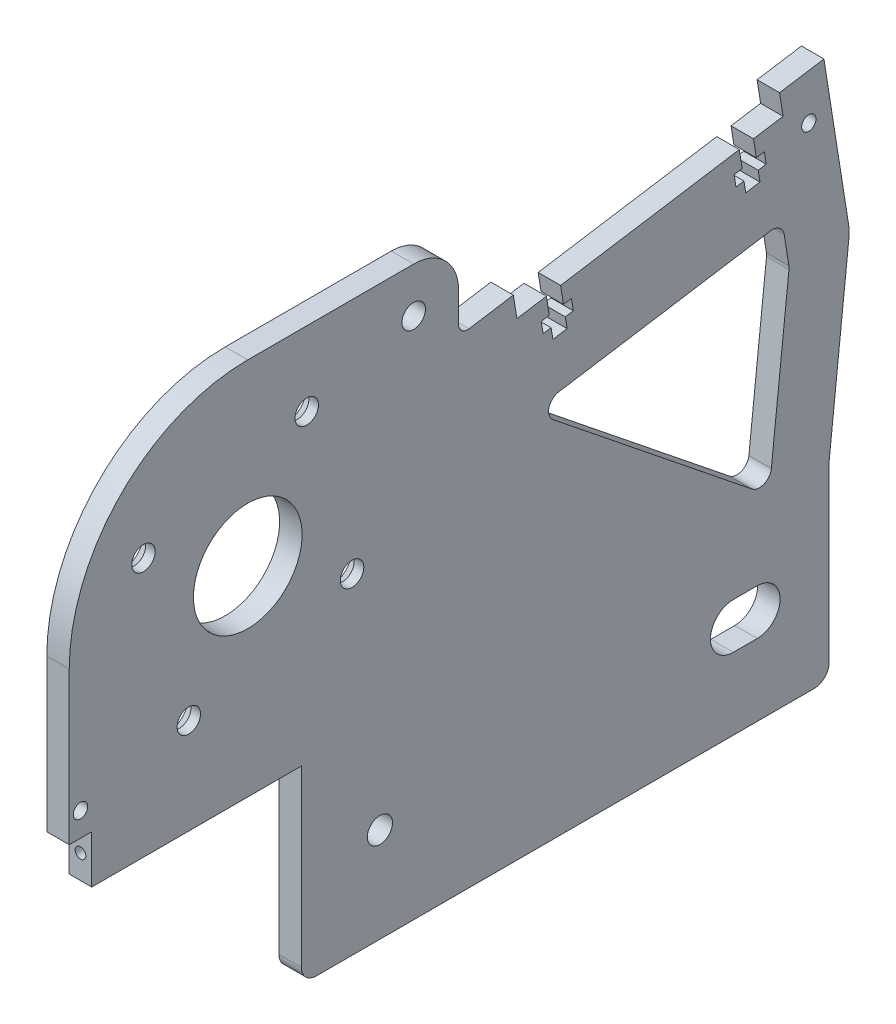
from build123d import *
from OCP.BRepFilletAPI import BRepFilletAPI_MakeChamfer

# Parameters (mm, degrees)
SKETCH1_R           = 2.4892
SKETCH1_R_2         = 2.667
SKETCH1_R_3         = 1.524
SKETCH1_R_4         = 11.522750336
BOSS_EXTRUDE1_DEPTH = 4.7625
SKETCH2_R           = 1.1303
CUT_EXTRUDE1_DEPTH  = 6.35
CHAMFER1_SIZE       = 2.7305
CHAMFER1_SIZE2      = 2.373587438


with BuildPart() as part:
    # Sketch1 → Boss-Extrude1 (new body)
    with BuildSketch(Plane(origin=(0, 0, 0), x_dir=(0, 0, -1), z_dir=(1, 0, 0))):
        with BuildLine():
            Line((-28.170295117, 0), (77.382795117, 0))
            ThreePointArc((77.382795117, 0), (79.627859148, 0.92993597), (80.557795117, 3.175))
            Line((80.557795117, 3.175), (80.557795117, 40.132))
            Line((80.557795117, 40.132), (84.771740045, 79.196103092))
            ThreePointArc((84.771740045, 79.196103092), (84.816236398, 80.272287311), (84.718413682, 81.344939685))
            Line((84.718413682, 81.344939685), (79.457064092, 114.563793628))
            Line((79.457064092, 114.563793628), (70.049332648, 113.073755348))
            Line((70.049332648, 113.073755348), (70.794351787, 108.369889626))
            Line((70.794351787, 108.369889626), (64.522530825, 107.376530773))
            Line((64.522530825, 107.376530773), (65.123512931, 103.582079091))
            Line((65.123512931, 103.582079091), (66.816904591, 103.850285981))
            Line((66.816904591, 103.850285981), (67.209281338, 101.372916701))
            Line((67.209281338, 101.372916701), (65.515889678, 101.10470981))
            Line((65.515889678, 101.10470981), (65.888399247, 98.752776949))
            Line((65.888399247, 98.752776949), (62.877925185, 98.2759647))
            Line((62.877925185, 98.2759647), (62.505415615, 100.627897561))
            Line((62.505415615, 100.627897561), (60.812023956, 100.359690671))
            Line((60.812023956, 100.359690671), (60.419647209, 102.837059951))
            Line((60.419647209, 102.837059951), (62.113038869, 103.105266841))
            Line((62.113038869, 103.105266841), (61.512056762, 106.899718524))
            Line((61.512056762, 106.899718524), (23.630258147, 100.899831052))
            Line((23.630258147, 100.899831052), (24.231240253, 97.105379369))
            Line((24.231240253, 97.105379369), (25.924631913, 97.373586259))
            Line((25.924631913, 97.373586259), (26.31700866, 94.896216979))
            Line((26.31700866, 94.896216979), (24.623617, 94.628010089))
            Line((24.623617, 94.628010089), (24.99612657, 92.276077228))
            Line((24.99612657, 92.276077228), (21.985652508, 91.799264978))
            Line((21.985652508, 91.799264978), (21.613142938, 94.151197839))
            Line((21.613142938, 94.151197839), (19.919751278, 93.882990949))
            Line((19.919751278, 93.882990949), (19.527374531, 96.360360229))
            Line((19.527374531, 96.360360229), (21.220766191, 96.62856712))
            Line((21.220766191, 96.62856712), (20.619784085, 100.423018802))
            Line((20.619784085, 100.423018802), (14.347963122, 99.429659949))
            Line((14.347963122, 99.429659949), (13.602943983, 104.133525671))
            Line((13.602943983, 104.133525671), (4.195212538, 102.643487392))
            ThreePointArc((4.195212538, 102.643487392), (2.66000635, 103.076460316), (1.992204883, 104.52503368))
            Line((1.992204883, 104.52503368), (1.992204883, 110.875))
            ThreePointArc((1.992204883, 110.875), (-0.797603027, 117.610192091), (-7.532795117, 120.4))
            Line((-7.532795117, 120.4), (-42.707795117, 120.4))
            ThreePointArc((-42.707795117, 120.4), (-69.471786785, 109.313991668), (-80.557795117, 82.55))
            Line((-80.557795117, 82.55), (-80.557795117, 50.292))
            Line((-80.557795117, 50.292), (-75.795295117, 50.292))
            Line((-75.795295117, 50.292), (-75.795295117, 40.132))
            Line((-75.795295117, 40.132), (-31.345295117, 40.132))
            Line((-31.345295117, 40.132), (-31.345295117, 3.175))
            ThreePointArc((-31.345295117, 3.175), (-30.415359148, 0.92993597), (-28.170295117, 0))
        make_face()
        with Locations((-55.209041359, 60.43939525)):
            Circle(SKETCH1_R, mode=Mode.SUBTRACT)
        with Locations((-14.692204883, 20.066)):
            Circle(SKETCH1_R_2, mode=Mode.SUBTRACT)
        with Locations((-20.597190367, 70.048753759)):
            Circle(SKETCH1_R, mode=Mode.SUBTRACT)
        with Locations((-64.818399868, 95.051246241)):
            Circle(SKETCH1_R, mode=Mode.SUBTRACT)
        with Locations((-30.206548876, 104.66060475)):
            Circle(SKETCH1_R, mode=Mode.SUBTRACT)
        with Locations((-78.176545117, 55.372)):
            Circle(SKETCH1_R_3, mode=Mode.SUBTRACT)
        with Locations((-42.707795117, 82.55)):
            Circle(SKETCH1_R_4, mode=Mode.SUBTRACT)
        with Locations((-7.532795117, 110.875)):
            Circle(SKETCH1_R, mode=Mode.SUBTRACT)
        with Locations((76.243236649, 104.411043044)):
            Circle(SKETCH1_R_3, mode=Mode.SUBTRACT)
        with BuildLine():
            Line((65.317795117, 15.2273), (60.237795117, 15.2273))
            ThreePointArc((60.237795117, 15.2273), (55.399095117, 20.066), (60.237795117, 24.9047))
            Line((60.237795117, 24.9047), (65.317795117, 24.9047))
            ThreePointArc((65.317795117, 24.9047), (70.156495117, 20.066), (65.317795117, 15.2273))
        make_face(mode=Mode.SUBTRACT)
        with BuildLine():
            Line((71.035861406, 86.549018926), (72.027193342, 80.289995416))
            ThreePointArc((72.027193342, 80.289995416), (72.057683184, 79.9556661), (72.043814352, 79.620235963))
            Line((72.043814352, 79.620235963), (68.302723543, 44.939584088))
            ThreePointArc((68.302723543, 44.939584088), (66.751491112, 42.866217372), (64.187855338, 43.230831164))
            Line((64.187855338, 43.230831164), (22.026684653, 77.057314107))
            ThreePointArc((22.026684653, 77.057314107), (21.161269703, 79.690326664), (23.218859921, 81.547211328))
            Line((23.218859921, 81.547211328), (68.12978948, 88.66040377))
            ThreePointArc((68.12978948, 88.66040377), (70.020107562, 88.206578551), (71.035861406, 86.549018926))
        make_face(mode=Mode.SUBTRACT)
    extrude(amount=BOSS_EXTRUDE1_DEPTH)

    # Sketch2 → Cut-Extrude1 (cut)
    with BuildSketch(Plane.XY.offset(75.795295117)):
        with Locations((2.38125, 45.212)):
            Circle(SKETCH2_R)
    extrude(amount=-CUT_EXTRUDE1_DEPTH, mode=Mode.SUBTRACT)

    # Chamfer1: one chamfer whose edges measure the first distance from different faces: ONE call of the kernel's chamfer builder (chamfer() names one face for all edges)
    chamfer1_edges_1 = [part.edges().sort_by_distance(p)[0] for p in [
        (0, 95.051246241, 67.307599868),
    ]]
    chamfer1_side_1 = [part.faces().sort_by_distance(p)[0] for p in [
        (2.38125, 95.051246241, 67.307599868),
    ]]
    chamfer1_edges_2 = [part.edges().sort_by_distance(p)[0] for p in [
        (0, 60.43939525, 57.698241359),
    ]]
    chamfer1_side_2 = [part.faces().sort_by_distance(p)[0] for p in [
        (2.38125, 60.43939525, 57.698241359),
    ]]
    chamfer1_edges_3 = [part.edges().sort_by_distance(p)[0] for p in [
        (0, 70.048753759, 23.086390367),
    ]]
    chamfer1_side_3 = [part.faces().sort_by_distance(p)[0] for p in [
        (2.38125, 70.048753759, 23.086390367),
    ]]
    chamfer1_edges_4 = [part.edges().sort_by_distance(p)[0] for p in [
        (0, 104.66060475, 32.695748876),
    ]]
    chamfer1_side_4 = [part.faces().sort_by_distance(p)[0] for p in [
        (2.38125, 104.66060475, 32.695748876),
    ]]
    chamfer1 = BRepFilletAPI_MakeChamfer(part.part.solid().wrapped)
    for e in chamfer1_edges_1:
        chamfer1.Add(CHAMFER1_SIZE, CHAMFER1_SIZE2, e.wrapped, chamfer1_side_1[0].wrapped)  # the first distance lies on this face
    for e in chamfer1_edges_2:
        chamfer1.Add(CHAMFER1_SIZE, CHAMFER1_SIZE2, e.wrapped, chamfer1_side_2[0].wrapped)  # the first distance lies on this face
    for e in chamfer1_edges_3:
        chamfer1.Add(CHAMFER1_SIZE, CHAMFER1_SIZE2, e.wrapped, chamfer1_side_3[0].wrapped)  # the first distance lies on this face
    for e in chamfer1_edges_4:
        chamfer1.Add(CHAMFER1_SIZE, CHAMFER1_SIZE2, e.wrapped, chamfer1_side_4[0].wrapped)  # the first distance lies on this face
    add(Compound.cast(chamfer1.Shape()), mode=Mode.REPLACE)


solid = part.part
